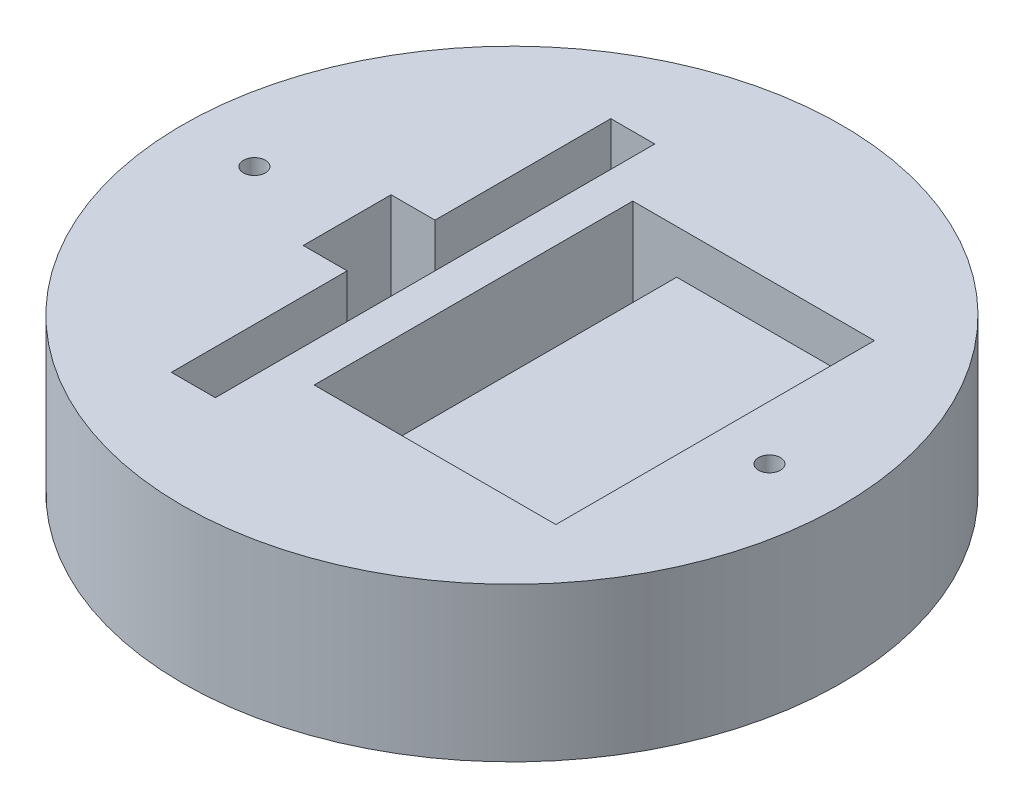
from build123d import *

# Parameters (mm, degrees)
SKETCH_3_R          = 15
EXTRUDE_2_DEPTH     = 7
CUT_EXTRUDE_1_DEPTH = 23.338307904
SKETCH_10_W         = 11
SKETCH_10_H         = 14.5
CUT_EXTRUDE_2_DEPTH = 2
SKETCH_11_W         = 2
SKETCH_11_H         = 14.5
CUT_EXTRUDE_3_DEPTH = 22.794494718
SKETCH_17_R         = 0.5
CUT_EXTRUDE_4_DEPTH = 23.338307904


with BuildPart() as part:
    # Эскиз3 → Бобышка-Вытянуть2 (new body)
    with BuildSketch(Plane(origin=(0, 0, 0), x_dir=(1, 0, 0), z_dir=(0, 1, 0))):
        Circle(SKETCH_3_R)
    extrude(amount=EXTRUDE_2_DEPTH)

    # Эскиз8 → Вырез-Вытянуть1 (cut, through all)
    with BuildSketch(Plane(origin=(0, 7, 0), x_dir=(1, 0, 0), z_dir=(0, 1, 0))):
        Polygon((-5.5, 10), (-3.5, 10), (-3.5, -10), (-5.5, -10), (-5.5, -2), (-7.5, -2), (-7.5, 2), (-5.5, 2), align=None)
    extrude(amount=-CUT_EXTRUDE_1_DEPTH, mode=Mode.SUBTRACT)

    # Эскиз10 → Вырез-Вытянуть2 (cut)
    with BuildSketch(Plane(origin=(0, 7, 0), x_dir=(1, 0, 0), z_dir=(0, 1, 0))):
        with Locations((3.75, 0)):
            Rectangle(SKETCH_10_W, SKETCH_10_H)
    extrude(amount=-CUT_EXTRUDE_2_DEPTH, mode=Mode.SUBTRACT)

    # Эскиз11 → Вырез-Вытянуть3 (cut, through all)
    with BuildSketch(Plane(origin=(0, 5, 0), x_dir=(1, 0, 0), z_dir=(0, 1, 0))):
        with Locations((-0.75, 0)):
            Rectangle(SKETCH_11_W, SKETCH_11_H)
    extrude(amount=-CUT_EXTRUDE_3_DEPTH, mode=Mode.SUBTRACT)

    # Эскиз17 → Вырез-Вытянуть4 (cut, through all)
    with BuildSketch(Plane(origin=(0, 7, 0), x_dir=(1, 0, 0), z_dir=(0, 1, 0))):
        with Locations((-11.720301431, 0)):
            Circle(SKETCH_17_R)
        with Locations((11.720301431, 0)):
            Circle(SKETCH_17_R)
    extrude(amount=-CUT_EXTRUDE_4_DEPTH, mode=Mode.SUBTRACT)


solid = part.part
